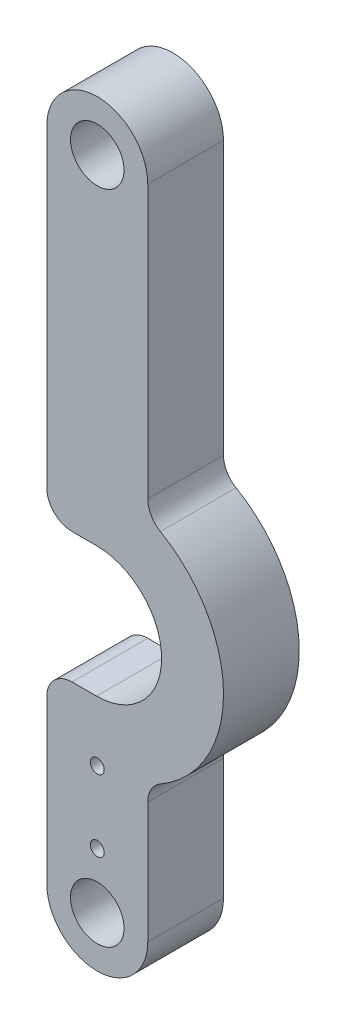
from build123d import *

# Parameters (mm, degrees)
F_4_BAR_LINKAGE_NON_DRIVEN_BAR_OUTLINE_R   = 3.3655
F_4_BAR_LINKAGE_NON_DRIVEN_BAR_OUTLINE_R_2 = 0.877000024
F_4_BAR_LINKAGE_NON_DRIVEN_BAR_DEPTH       = 9.525
BOSS_EXTRUDE2_DEPTH                        = 9.525
CUT_EXTRUDE1_DEPTH                         = 91.807220253
FILLET1_R                                  = 3.175
FILLET3_R                                  = 3.175


# Read off the part's stored shape, not the designer's step: 4 bar linkage non-driven bar
with BuildPart() as part:
    # 4 bar linkage non-driven bar outline → 4 bar linkage non-driven bar (new body)
    with BuildSketch(Plane.XY):
        with BuildLine():
            ThreePointArc((-6.35, 0), (0, -6.35), (6.35, 0))
            Line((6.35, 0), (6.35, 82.55))
            ThreePointArc((6.35, 82.55), (0, 88.9), (-6.35, 82.55))
            Line((-6.35, 82.55), (-6.35, 0))
        make_face()
        Circle(F_4_BAR_LINKAGE_NON_DRIVEN_BAR_OUTLINE_R, mode=Mode.SUBTRACT)
        with Locations((0, 6.99999997)):
            Circle(F_4_BAR_LINKAGE_NON_DRIVEN_BAR_OUTLINE_R_2, mode=Mode.SUBTRACT)
        with Locations((0, 16.000000004)):
            Circle(F_4_BAR_LINKAGE_NON_DRIVEN_BAR_OUTLINE_R_2, mode=Mode.SUBTRACT)
        with Locations((0, 82.55)):
            Circle(F_4_BAR_LINKAGE_NON_DRIVEN_BAR_OUTLINE_R, mode=Mode.SUBTRACT)
    extrude(amount=F_4_BAR_LINKAGE_NON_DRIVEN_BAR_DEPTH)

    # Sketch2 → Boss-Extrude2 (add)
    with BuildSketch(Plane.XY.offset(9.525)):
        with BuildLine():
            Line((6.35, 17.200322169), (6.35, 46.299677831))
            ThreePointArc((6.35, 46.299677831), (15.875, 31.75), (6.35, 17.200322169))
        make_face()
    extrude(amount=-BOSS_EXTRUDE2_DEPTH)

    # Sketch1 → Cut-Extrude1 (cut, through all)
    with BuildSketch(Plane.XY.offset(9.525)):
        with BuildLine():
            Line((-0.096808673, 39.9415), (-6.35, 39.9415))
            Line((-6.35, 39.9415), (-6.35, 23.5585))
            Line((-6.35, 23.5585), (-0.096808673, 23.5585))
            ThreePointArc((-0.096808673, 23.5585), (8.094691327, 31.75), (-0.096808673, 39.9415))
        make_face()
    extrude(amount=-CUT_EXTRUDE1_DEPTH, mode=Mode.SUBTRACT)

    # Fillet1
    fillet1_edges = [part.edges().sort_by_distance(p)[0] for p in [
        (-6.35, 23.5585, 4.7625),
        (-6.35, 39.9415, 4.7625),
    ]]
    fillet(fillet1_edges, radius=FILLET1_R)

    # Fillet3
    fillet3_edges = [part.edges().sort_by_distance(p)[0] for p in [
        (6.35, 46.299677831, 4.7625),
        (6.35, 17.200322169, 4.7625),
    ]]
    fillet(fillet3_edges, radius=FILLET3_R)


solid = part.part
